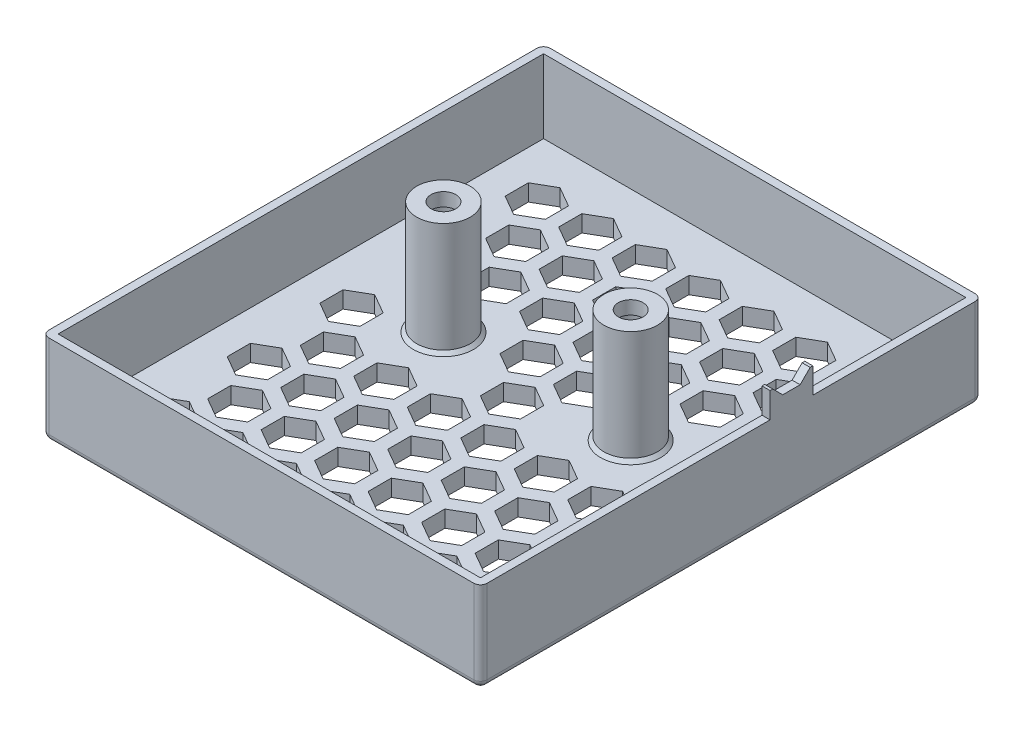
from build123d import *

# Parameters (mm, degrees)
SKETCH1_W           = 65.56
SKETCH1_H           = 75
BOSS_EXTRUDE1_DEPTH = 2.5
SKETCH2_W           = 65.56
SKETCH2_H           = 75
SKETCH2_W_2         = 63.16
SKETCH2_H_2         = 72.6
BOSS_EXTRUDE2_DEPTH = 11
BOSS_EXTRUDE3_DEPTH = 1.2
SKETCH7_R           = 4
BOSS_EXTRUDE5_DEPTH = 16.9
SKETCH8_R           = 2.75
CUT_EXTRUDE4_DEPTH  = 17.4
SKETCH9_R           = 1.85
CUT_EXTRUDE3_DEPTH  = 2
FILLET1_R           = 1
CHAMFER2_SIZE       = 0.5
FILL_PATTERN1_DEPTH = 2.5


# Read off the part's stored shape, not the designer's step: Fill Pattern1
with BuildPart() as part:
    # Sketch1 → Boss-Extrude1 (new body)
    with BuildSketch(Plane(origin=(0, 0, 0), x_dir=(1, 0, 0), z_dir=(0, 1, 0))):
        Rectangle(SKETCH1_W, SKETCH1_H)
    extrude(amount=BOSS_EXTRUDE1_DEPTH)

    # Sketch2 → Boss-Extrude2 (add)
    with BuildSketch(Plane(origin=(0, 2.5, 0), x_dir=(1, 0, 0), z_dir=(0, 1, 0))):
        Rectangle(SKETCH2_W, SKETCH2_H)
        Rectangle(SKETCH2_W_2, SKETCH2_H_2, mode=Mode.SUBTRACT)
    extrude(amount=BOSS_EXTRUDE2_DEPTH)

    # Sketch4 → Boss-Extrude3 (add)
    with BuildSketch(Plane(origin=(32.78, 0, 0), x_dir=(0, 0, -1), z_dir=(1, 0, 0))):
        Polygon((5.81, 13.5), (12.21, 13.5), (12.21, 15.8), (12.21, 17.3), (11.81, 17.3), (10.31, 15.8), (7.71, 15.8), (6.21, 17.3), (5.81, 17.3), (5.81, 15.8), align=None)
    extrude(amount=-BOSS_EXTRUDE3_DEPTH)

    # Sketch7 → Boss-Extrude5 (add)
    with BuildSketch(Plane(origin=(0, 2.5, 0), x_dir=(1, 0, 0), z_dir=(0, 1, 0))):
        with Locations(Location((14, 3.75, 0), (0, 0, 90))):
            Circle(SKETCH7_R)
        with Locations(Location((-14, 3.75, 0), (0, 0, 90))):
            Circle(SKETCH7_R)
    extrude(amount=BOSS_EXTRUDE5_DEPTH)

    # Sketch8 → Cut-Extrude4 (cut)
    with BuildSketch(Plane(origin=(0, 0, 0), x_dir=(1, 0, 0), z_dir=(0, 1, 0))):
        with Locations(Location((14, 3.75, 0), (0, 0, 270))):
            Circle(SKETCH8_R)
        with Locations(Location((-14, 3.75, 0), (0, 0, 270))):
            Circle(SKETCH8_R)
    extrude(amount=CUT_EXTRUDE4_DEPTH, mode=Mode.SUBTRACT)

    # Sketch9 → Cut-Extrude3 (cut)
    with BuildSketch(Plane(origin=(0, 19.4, 0), x_dir=(1, 0, 0), z_dir=(0, 1, 0))):
        with Locations(Location((-14, 3.75, 0), (0, 0, 270))):
            Circle(SKETCH9_R)
        with Locations(Location((14, 3.75, 0), (0, 0, 270))):
            Circle(SKETCH9_R)
    extrude(amount=-CUT_EXTRUDE3_DEPTH, mode=Mode.SUBTRACT)

    # Fillet1
    fillet1_edges = [part.edges().sort_by_distance(p)[0] for p in [
        (0, 0, 37.5),
        (-32.78, 0, 0),
        (0, 0, -37.5),
        (32.78, 0, 0),
        (32.78, 6.75, 37.5),
        (-32.78, 6.75, 37.5),
        (-32.78, 6.75, -37.5),
        (32.78, 6.75, -37.5),
    ]]
    fillet(fillet1_edges, radius=FILLET1_R)

    # Chamfer2
    chamfer2_edges = [part.edges().sort_by_distance(p)[0] for p in [
        (14, 2.5, 0.25),
        (-14, 2.5, 0.25),
    ]]
    chamfer(chamfer2_edges, length=CHAMFER2_SIZE)

    # Fill Pattern1 outline → Fill Pattern1 (cut)
    with BuildSketch(Plane(origin=(0, 0, 0), x_dir=(1, 0, 0), z_dir=(0, 1, 0))):
        Polygon((-21, 29.444863729), (-24, 31.176914536), (-27, 29.444863729), (-27, 25.980762114), (-24, 24.248711306), (-21, 25.980762114), align=None)
        Polygon((3, 15.588457268), (0, 17.320508076), (-3, 15.588457268), (-3, 12.124355653), (0, 10.392304845), (3, 12.124355653), align=None)
        Polygon((27, 1.732050808), (24, 3.464101615), (21, 1.732050808), (21, -1.732050808), (24, -3.464101615), (27, -1.732050808), align=None)
        Polygon((-9, 22.516660498), (-12, 24.248711306), (-15, 22.516660498), (-15, 19.052558883), (-12, 17.320508076), (-9, 19.052558883), align=None)
        Polygon((-27, -25.980762114), (-27, -29.444863729), (-24, -31.176914536), (-21, -29.444863729), (-21, -25.980762114), (-24, -24.248711306), align=None)
        Polygon((-27, -12.124355653), (-27, -15.588457268), (-24, -17.320508076), (-21, -15.588457268), (-21, -12.124355653), (-24, -10.392304845), align=None)
        Polygon((-27, 1.732050808), (-27, -1.732050808), (-24, -3.464101615), (-21, -1.732050808), (-21, 1.732050808), (-24, 3.464101615), align=None)
        Polygon((-27, 15.588457268), (-27, 12.124355653), (-24, 10.392304845), (-21, 12.124355653), (-21, 15.588457268), (-24, 17.320508076), align=None)
        Polygon((23, 22.516660498), (20, 24.248711306), (17, 22.516660498), (17, 19.052558883), (20, 17.320508076), (23, 19.052558883), align=None)
        Polygon((11, 29.444863729), (8, 31.176914536), (5, 29.444863729), (5, 25.980762114), (8, 24.248711306), (11, 25.980762114), align=None)
        Polygon((8, 17.320508076), (5, 15.588457268), (5, 12.124355653), (8, 10.392304845), (11, 12.124355653), (11, 15.588457268), align=None)
        Polygon((-4, 10.392304845), (-7, 8.660254038), (-7, 5.196152423), (-4, 3.464101615), (-1, 5.196152423), (-1, 8.660254038), align=None)
        Polygon((17, -5.196152423), (17, -8.660254038), (20, -10.392304845), (23, -8.660254038), (23, -5.196152423), (20, -3.464101615), align=None)
        Polygon((17, -19.052558883), (17, -22.516660498), (20, -24.248711306), (23, -22.516660498), (23, -19.052558883), (20, -17.320508076), align=None)
        Polygon((7, 8.660254038), (4, 10.392304845), (1, 8.660254038), (1, 5.196152423), (4, 3.464101615), (7, 5.196152423), align=None)
        Polygon((-17, 22.516660498), (-20, 24.248711306), (-23, 22.516660498), (-23, 19.052558883), (-20, 17.320508076), (-17, 19.052558883), align=None)
        Polygon((-5, 15.588457268), (-8, 17.320508076), (-11, 15.588457268), (-11, 12.124355653), (-8, 10.392304845), (-5, 12.124355653), align=None)
        Polygon((16, 17.320508076), (13, 15.588457268), (13, 12.124355653), (16, 10.392304845), (19, 12.124355653), (19, 15.588457268), align=None)
        Polygon((-20, -3.464101615), (-23, -5.196152423), (-23, -8.660254038), (-20, -10.392304845), (-17, -8.660254038), (-17, -5.196152423), align=None)
        Polygon((1, 22.516660498), (1, 19.052558883), (4, 17.320508076), (7, 19.052558883), (7, 22.516660498), (4, 24.248711306), align=None)
        Polygon((1, -5.196152423), (1, -8.660254038), (4, -10.392304845), (7, -8.660254038), (7, -5.196152423), (4, -3.464101615), align=None)
        Polygon((1, -19.052558883), (1, -22.516660498), (4, -24.248711306), (7, -22.516660498), (7, -19.052558883), (4, -17.320508076), align=None)
        Polygon((24, 31.176914536), (21, 29.444863729), (21, 25.980762114), (24, 24.248711306), (27, 25.980762114), (27, 29.444863729), align=None)
        Polygon((12, 24.248711306), (9, 22.516660498), (9, 19.052558883), (12, 17.320508076), (15, 19.052558883), (15, 22.516660498), align=None)
        Polygon((-3, 29.444863729), (-3, 25.980762114), (0, 24.248711306), (3, 25.980762114), (3, 29.444863729), (0, 31.176914536), align=None)
        Polygon((-3, 1.732050808), (-3, -1.732050808), (0, -3.464101615), (3, -1.732050808), (3, 1.732050808), (0, 3.464101615), align=None)
        Polygon((-3, -25.980762114), (-3, -29.444863729), (0, -31.176914536), (3, -29.444863729), (3, -25.980762114), (0, -24.248711306), align=None)
        Polygon((-3, -12.124355653), (-3, -15.588457268), (0, -17.320508076), (3, -15.588457268), (3, -12.124355653), (0, -10.392304845), align=None)
        Polygon((12, -3.464101615), (9, -5.196152423), (9, -8.660254038), (12, -10.392304845), (15, -8.660254038), (15, -5.196152423), align=None)
        Polygon((-12, -17.320508076), (-15, -19.052558883), (-15, -22.516660498), (-12, -24.248711306), (-9, -22.516660498), (-9, -19.052558883), align=None)
        Polygon((21, 15.588457268), (21, 12.124355653), (24, 10.392304845), (27, 12.124355653), (27, 15.588457268), (24, 17.320508076), align=None)
        Polygon((21, -25.980762114), (21, -29.444863729), (24, -31.176914536), (27, -29.444863729), (27, -25.980762114), (24, -24.248711306), align=None)
        Polygon((21, -12.124355653), (21, -15.588457268), (24, -17.320508076), (27, -15.588457268), (27, -12.124355653), (24, -10.392304845), align=None)
        Polygon((-16, 17.320508076), (-19, 15.588457268), (-19, 12.124355653), (-16, 10.392304845), (-13, 12.124355653), (-13, 15.588457268), align=None)
        Polygon((-4, 24.248711306), (-7, 22.516660498), (-7, 19.052558883), (-4, 17.320508076), (-1, 19.052558883), (-1, 22.516660498), align=None)
        Polygon((5, -25.980762114), (5, -29.444863729), (8, -31.176914536), (11, -29.444863729), (11, -25.980762114), (8, -24.248711306), align=None)
        Polygon((5, -12.124355653), (5, -15.588457268), (8, -17.320508076), (11, -15.588457268), (11, -12.124355653), (8, -10.392304845), align=None)
        Polygon((-5, 29.444863729), (-8, 31.176914536), (-11, 29.444863729), (-11, 25.980762114), (-8, 24.248711306), (-5, 25.980762114), align=None)
        Polygon((16, 31.176914536), (13, 29.444863729), (13, 25.980762114), (16, 24.248711306), (19, 25.980762114), (19, 29.444863729), align=None)
        Polygon((-13, 29.444863729), (-16, 31.176914536), (-19, 29.444863729), (-19, 25.980762114), (-16, 24.248711306), (-13, 25.980762114), align=None)
        Polygon((-4, -17.320508076), (-7, -19.052558883), (-7, -22.516660498), (-4, -24.248711306), (-1, -22.516660498), (-1, -19.052558883), align=None)
        Polygon((-16, -24.248711306), (-19, -25.980762114), (-19, -29.444863729), (-16, -31.176914536), (-13, -29.444863729), (-13, -25.980762114), align=None)
        Polygon((9, -19.052558883), (9, -22.516660498), (12, -24.248711306), (15, -22.516660498), (15, -19.052558883), (12, -17.320508076), align=None)
        Polygon((19, -12.124355653), (16, -10.392304845), (13, -12.124355653), (13, -15.588457268), (16, -17.320508076), (19, -15.588457268), align=None)
        Polygon((-20, -17.320508076), (-23, -19.052558883), (-23, -22.516660498), (-20, -24.248711306), (-17, -22.516660498), (-17, -19.052558883), align=None)
        Polygon((-8, -10.392304845), (-11, -12.124355653), (-11, -15.588457268), (-8, -17.320508076), (-5, -15.588457268), (-5, -12.124355653), align=None)
        Polygon((-12, -3.464101615), (-15, -5.196152423), (-15, -8.660254038), (-12, -10.392304845), (-9, -8.660254038), (-9, -5.196152423), align=None)
        Polygon((-7, -5.196152423), (-7, -8.660254038), (-4, -10.392304845), (-1, -8.660254038), (-1, -5.196152423), (-4, -3.464101615), align=None)
        Polygon((13, -25.980762114), (13, -29.444863729), (16, -31.176914536), (19, -29.444863729), (19, -25.980762114), (16, -24.248711306), align=None)
        Polygon((-19, -12.124355653), (-19, -15.588457268), (-16, -17.320508076), (-13, -15.588457268), (-13, -12.124355653), (-16, -10.392304845), align=None)
        Polygon((-5, -25.980762114), (-8, -24.248711306), (-11, -25.980762114), (-11, -29.444863729), (-8, -31.176914536), (-5, -29.444863729), align=None)
    extrude(amount=FILL_PATTERN1_DEPTH, mode=Mode.SUBTRACT)


solid = part.part
